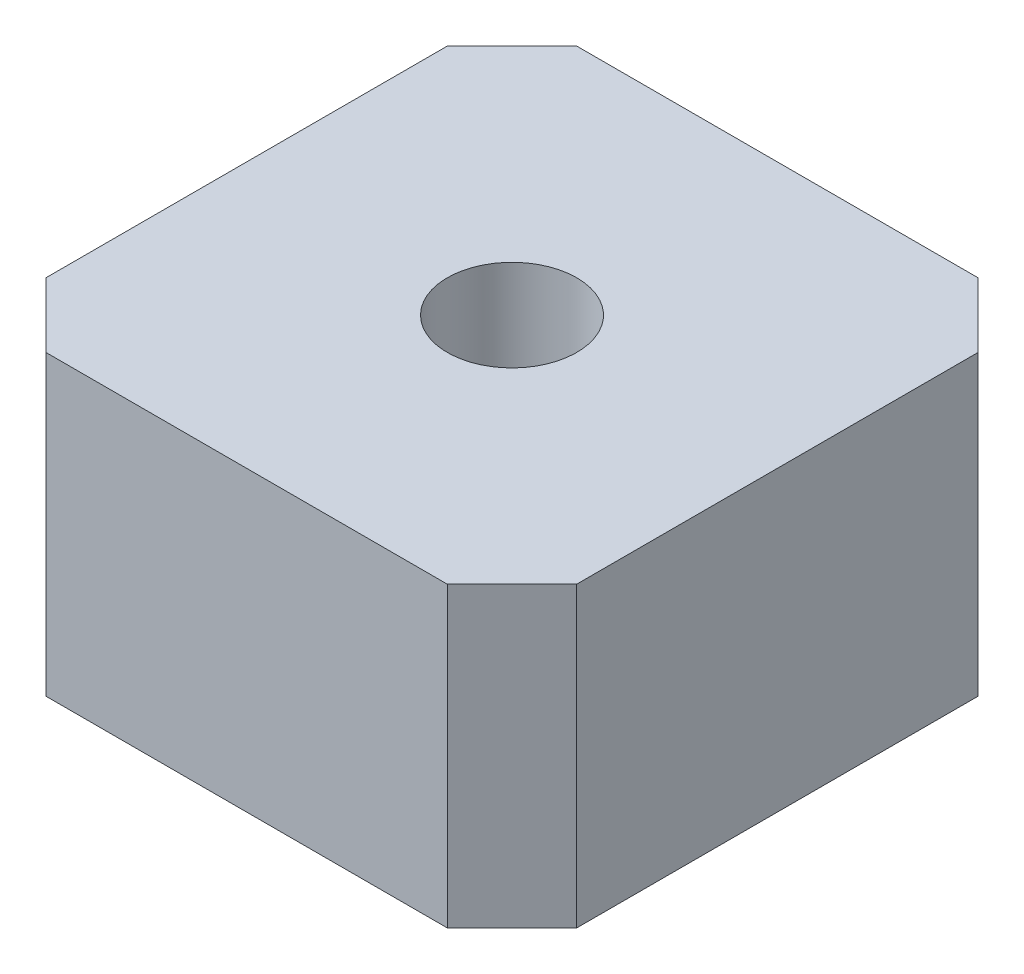
from build123d import *

# Parameters (mm, degrees)
SKETCH1_W           = 41
SKETCH1_H           = 41
BOSS_EXTRUDE1_DEPTH = 23
CHAMFER1_SIZE       = 5
SKETCH2_R           = 5
CUT_EXTRUDE1_DEPTH  = 38.00675614


with BuildPart() as part:
    # Sketch1 → Boss-Extrude1 (new body)
    with BuildSketch(Plane(origin=(0, 0, 0), x_dir=(1, 0, 0), z_dir=(0, 1, 0))):
        Rectangle(SKETCH1_W, SKETCH1_H)
    extrude(amount=BOSS_EXTRUDE1_DEPTH)

    # Chamfer1
    chamfer1_edges = [part.edges().sort_by_distance(p)[0] for p in [
        (20.5, 11.5, 20.5),
        (20.5, 11.5, -20.5),
        (-20.5, 11.5, 20.5),
        (-20.5, 11.5, -20.5),
    ]]
    chamfer(chamfer1_edges, length=CHAMFER1_SIZE)

    # Sketch2 → Cut-Extrude1 (cut, through all)
    with BuildSketch(Plane.XZ):
        Circle(SKETCH2_R)
    extrude(amount=-CUT_EXTRUDE1_DEPTH, mode=Mode.SUBTRACT)


solid = part.part
